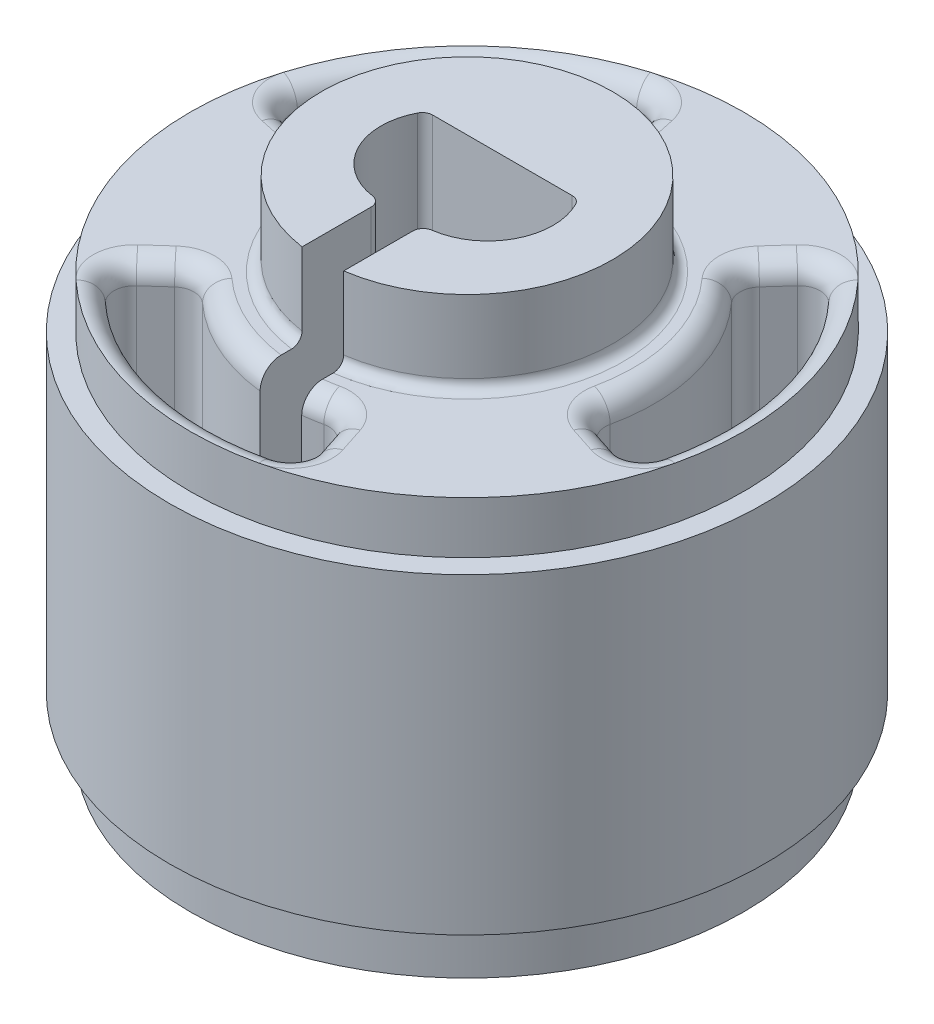
from build123d import *

# Parameters (mm, degrees)
CUT_EXTRUDE1_DEPTH       = 15.221286862
FILLET1_R                = 0.5
FILLET2_R                = 0.5
CIRPATTERN1_COUNT        = 3
FILLET1_OF_CIRPATTERN1_R = 0.5
FILLET2_OF_CIRPATTERN1_R = 0.5
CUT_EXTRUDE3_DEPTH       = 16.692195589
FILLET3_R                = 0.25
FILLET4_R                = 0.25


with BuildPart() as part:
    # Sketch1 → Revolve1 (revolve)
    with BuildSketch(Plane(origin=(0, 0, 0), x_dir=(0, 0, -1), z_dir=(1, 0, 0)), mode=Mode.PRIVATE) as revolve1_sk:
        Polygon((0, -6), (6.65, -6), (6.65, -4.75), (7.15, -4.75), (7.15, 2.75), (6.65, 2.75), (6.65, 4), (3.5, 4), (3.5, 6), (0, 6), align=None)
    revolve(revolve1_sk.sketch.rotate(Axis((0, 7.622905435, 0), (0, -1, 0)), 180), axis=Axis((0, 7.622905435, 0), (0, -1, 0)))

    # Sketch2 → Cut-Extrude1 (cut, through all)
    with BuildSketch(Plane(origin=(0, 4, 0), x_dir=(1, 0, 0), z_dir=(0, 1, 0))):
        with BuildLine():
            Line((-1.278656899, 6.015607745), (-0.935602609, 4.401664203))
            ThreePointArc((-0.935602609, 4.401664203), (-3.181980515, 3.181980515), (-4.401664203, 0.935602609))
            Line((-4.401664203, 0.935602609), (-6.015607745, 1.278656899))
            ThreePointArc((-6.015607745, 1.278656899), (-4.348706704, 4.348706704), (-1.278656899, 6.015607745))
        make_face()
    cut_extrude1 = extrude(amount=-CUT_EXTRUDE1_DEPTH, mode=Mode.SUBTRACT)

    # Fillet1
    fillet1_edges = [part.edges().sort_by_distance(p)[0] for p in [
        (-6.015607745, -1, -1.278656899),
        (-1.278656899, -1, -6.015607745),
        (-0.935602609, -1, -4.401664203),
        (-4.401664203, -1, -0.935602609),
    ]]
    fillet(fillet1_edges, radius=FILLET1_R)

    # Fillet2
    fillet2_edges = [part.edges().sort_by_distance(p)[0] for p in [
        (-3.181980515, 4, -3.181980515),
        (-3.181980515, -6, -3.181980515),
        (-5.185536923, 4, -1.102219899),
        (-5.185536923, -6, -1.102219899),
        (-4.348706704, 4, -4.348706704),
        (-4.348706704, -6, -4.348706704),
        (-1.102219899, 4, -5.185536923),
        (-1.102219899, -6, -5.185536923),
        (-4.511282066, 4, -1.090978863),
        (-4.511282066, -6, -1.090978863),
        (-1.405686601, 4, -5.831880276),
        (-1.405686601, -6, -5.831880276),
        (-5.831880276, 4, -1.405686601),
        (-5.831880276, -6, -1.405686601),
        (-1.090978863, 4, -4.511282066),
        (-1.090978863, -6, -4.511282066),
    ]]
    fillet(fillet2_edges, radius=FILLET2_R - 0.0001)  # a hair under: the kernel refuses the full size

    # CirPattern1: Cut-Extrude1 ×3 about axis
    cirpattern1_axis = Axis((0, 0, 0), (0, 1, 0))
    for i in range(1, CIRPATTERN1_COUNT):
        add(cut_extrude1.rotate(cirpattern1_axis, i * 360 / CIRPATTERN1_COUNT), mode=Mode.SUBTRACT)

    # Fillet1 of CirPattern1
    fillet1_of_cirpattern1_edges = [part.edges().sort_by_distance(p)[0] for p in [
        (1.900454515, -1, 5.848997575),
        (-4.570340677, -1, 4.115153229),
        (-3.344151715, -1, 3.011087729),
        (1.390576475, -1, 4.279754323),
        (4.115153229, -1, -4.570340677),
        (5.848997575, -1, 1.900454515),
        (4.279754323, -1, 1.390576475),
        (3.011087729, -1, -3.344151715),
    ]]
    fillet(fillet1_of_cirpattern1_edges, radius=FILLET1_OF_CIRPATTERN1_R)

    # Fillet2 of CirPattern1
    fillet2_of_cirpattern1_edges = [part.edges().sort_by_distance(p)[0] for p in [
        (-1.164685703, 4, 4.346666218),
        (-1.164685703, -6, 4.346666218),
        (1.638218029, 4, 5.041916657),
        (1.638218029, -6, 5.041916657),
        (-1.591737127, 4, 5.940443832),
        (-1.591737127, -6, 5.940443832),
        (-3.939696758, 4, 3.547318895),
        (-3.939696758, -6, 3.547318895),
        (1.310825622, 4, 4.452374304),
        (1.310825622, -6, 4.452374304),
        (-4.34771317, 4, 4.133300444),
        (-4.34771317, -6, 4.133300444),
        (1.698579831, 4, 5.753399771),
        (1.698579831, -6, 5.753399771),
        (-3.361395441, 4, 3.200456444),
        (-3.361395441, -6, 3.200456444),
        (4.346666218, 4, -1.164685703),
        (4.346666218, -6, -1.164685703),
        (3.547318895, 4, -3.939696758),
        (3.547318895, -6, -3.939696758),
        (5.940443832, 4, -1.591737127),
        (5.940443832, -6, -1.591737127),
        (5.041916657, 4, 1.638218029),
        (5.041916657, -6, 1.638218029),
        (3.200456444, 4, -3.361395441),
        (3.200456444, -6, -3.361395441),
        (5.753399771, 4, 1.698579831),
        (5.753399771, -6, 1.698579831),
        (4.133300444, 4, -4.34771317),
        (4.133300444, -6, -4.34771317),
        (4.452374304, 4, 1.310825622),
        (4.452374304, -6, 1.310825622),
    ]]
    fillet(fillet2_of_cirpattern1_edges, radius=FILLET2_OF_CIRPATTERN1_R - 0.0001)  # a hair under: the kernel refuses the full size

    # Sketch3 → Cut-Extrude3 (cut, through all)
    with BuildSketch(Plane(origin=(0, 6, 0), x_dir=(1, 0, 0), z_dir=(0, 1, 0))):
        with BuildLine():
            Line((-0.5, -5.57), (-0.5, -1.57))
            ThreePointArc((-0.5, -1.57), (-1.878296049, -0.751797845), (-1.82, 0.85))
            Line((-1.82, 0.85), (1.82, 0.85))
            ThreePointArc((1.82, 0.85), (1.878296049, -0.751797845), (0.5, -1.57))
            Line((0.5, -1.57), (0.5, -5.57))
            Line((0.5, -5.57), (-0.5, -5.57))
        make_face()
    extrude(amount=-CUT_EXTRUDE3_DEPTH, mode=Mode.SUBTRACT)

    # Fillet3
    fillet3_edges = [part.edges().sort_by_distance(p)[0] for p in [
        (0.5, 0, 1.57),
        (-0.5, 0, 1.57),
        (-1.82, 0, -0.85),
        (1.82, 0, -0.85),
    ]]
    fillet(fillet3_edges, radius=FILLET3_R)

    # Fillet4
    fillet4_edges = [part.edges().sort_by_distance(p)[0] for p in [
        (0, 4, -3.5),
    ]]
    fillet(fillet4_edges, radius=FILLET4_R)


solid = part.part
